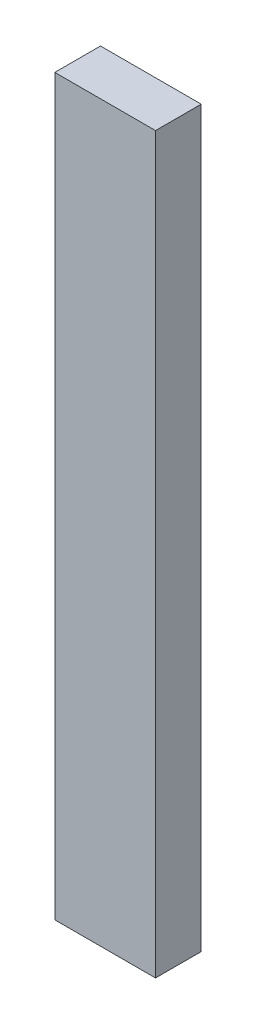
from build123d import *

# Parameters (mm, degrees)
SKETCH1_W           = 54
SKETCH1_H           = 24.5
BOSS_EXTRUDE1_DEPTH = 393.4


with BuildPart() as part:
    # Sketch1 → Boss-Extrude1 (new body)
    with BuildSketch(Plane(origin=(0, 0, 0), x_dir=(1, 0, 0), z_dir=(0, 1, 0))):
        with Locations((27, 12.25)):
            Rectangle(SKETCH1_W, SKETCH1_H)
    extrude(amount=BOSS_EXTRUDE1_DEPTH)


solid = part.part
